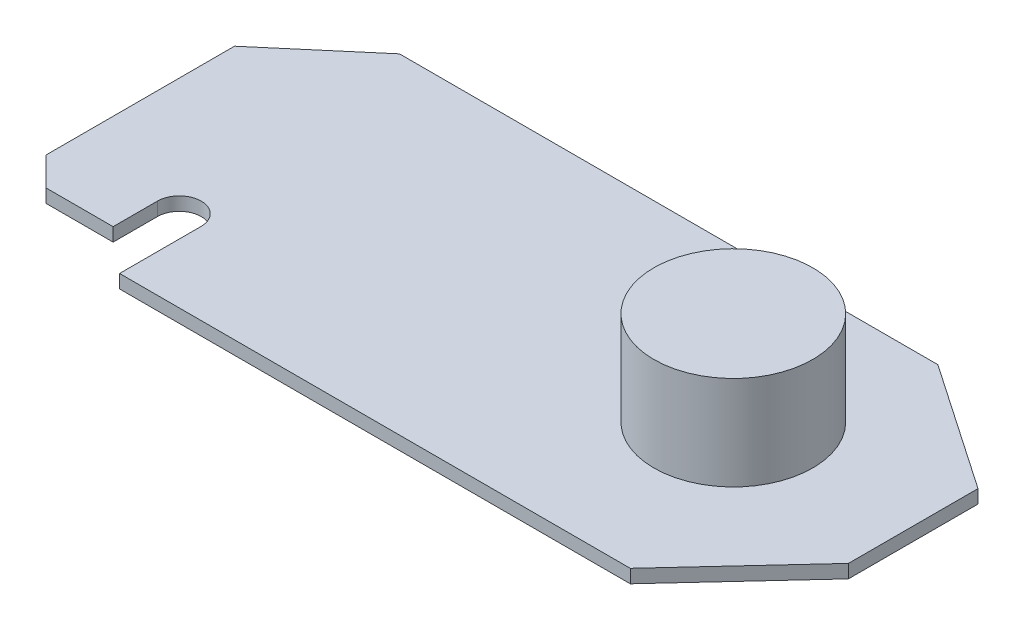
from build123d import *

# Parameters (mm, degrees)
BOSS_EXTRUDE1_DEPTH = 1
SKETCH2_R           = 5.92
BOSS_EXTRUDE2_DEPTH = 7


with BuildPart() as part:
    # Sketch1 → Boss-Extrude1 (new body)
    with BuildSketch(Plane(origin=(0, 0, 0), x_dir=(1, 0, 0), z_dir=(0, 1, 0))):
        with BuildLine():
            Line((32.192926975, 5.731541662), (32.192926975, -3.918458338))
            Line((32.192926975, -3.918458338), (24.385672195, -12.362199973))
            Line((24.385672195, -12.362199973), (-13.654327805, -12.362199973))
            Line((-13.654327805, -12.362199973), (-13.654327805, -6.282199973))
            ThreePointArc((-13.654327805, -6.282199973), (-15.284327805, -4.652199973), (-16.914327805, -6.282199973))
            Line((-16.914327805, -6.282199973), (-16.914327805, -9.582199973))
            Line((-16.914327805, -9.582199973), (-21.914327805, -9.582199973))
            Line((-21.914327805, -9.582199973), (-24.035648148, -7.46087963))
            Line((-24.035648148, -7.46087963), (-24.035648148, 6.57912037))
            Line((-24.035648148, 6.57912037), (-17.39471873, 12.23035532))
            Line((-17.39471873, 12.23035532), (22.70528127, 12.23035532))
            Line((22.70528127, 12.23035532), (32.192926975, 5.731541662))
        make_face()
    extrude(amount=BOSS_EXTRUDE1_DEPTH)

    # Sketch2 → Boss-Extrude2 (add)
    with BuildSketch(Plane(origin=(0, 1, 0), x_dir=(1, 0, 0), z_dir=(0, 1, 0))):
        with Locations((18.792926975, 0.906541662)):
            Circle(SKETCH2_R)
    extrude(amount=BOSS_EXTRUDE2_DEPTH)


solid = part.part
